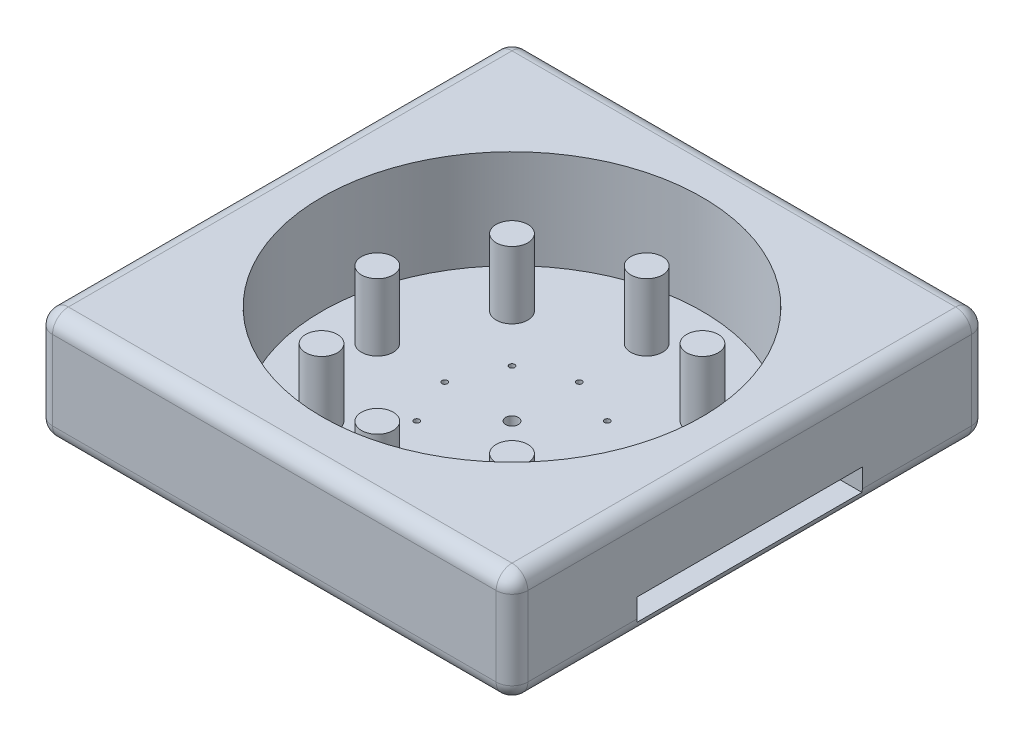
from build123d import *

# Parameters (mm, degrees)
SKETCH_1_W          = 300
SKETCH_1_H          = 300
EXTRUDE_1_DEPTH     = 150
SKETCH_2_R          = 120
CUT_EXTRUDE_1_DEPTH = 62.3
SKETCH_3_R          = 1.75
SKETCH_3_R_2        = 4
CUT_EXTRUDE_2_DEPTH = 10
SKETCH_6_W          = 142.15649329
SKETCH_6_H          = 14
CUT_EXTRUDE_4_DEPTH = 75
SKETCH_11_R         = 10
EXTRUDE_4_DEPTH     = 42.3
FILLET_1_R          = 10
SKETCH_13_W         = 300
SKETCH_13_H         = 300
CUT_EXTRUDE_5_DEPTH = 80
SKETCH_14_R         = 25
EXTRUDE_5_DEPTH     = 5
FILLET_2_R          = 10


with BuildPart() as part:
    # 草图1 → 凸台-拉伸1 (new body)
    with BuildSketch(Plane(origin=(0, 0, 0), x_dir=(1, 0, 0), z_dir=(0, 1, 0))):
        Rectangle(SKETCH_1_W, SKETCH_1_H)
    extrude(amount=EXTRUDE_1_DEPTH)

    # 草图2 → 切除-拉伸1 (cut)
    with BuildSketch(Plane(origin=(0, 150, 0), x_dir=(1, 0, 0), z_dir=(0, 1, 0))):
        with Locations(Location((0, 0, 0), (0, 0, 270))):
            Circle(SKETCH_2_R)
    extrude(amount=-CUT_EXTRUDE_1_DEPTH, mode=Mode.SUBTRACT)

    # 草图3 → 切除-拉伸2 (cut)
    with BuildSketch(Plane(origin=(0, 87.7, 0), x_dir=(1, 0, 0), z_dir=(0, 1, 0))):
        with Locations(Location((42.5, 0, 0), (0, 0, 270))):
            Circle(SKETCH_3_R)
        with Locations(Location((30.0520382, -30.0520382, 0), (0, 0, 270))):
            Circle(SKETCH_3_R)
        with Locations(Location((0, -42.5, 0), (0, 0, 270))):
            Circle(SKETCH_3_R)
        with Locations(Location((-30.0520382, -30.0520382, 0), (0, 0, 270))):
            Circle(SKETCH_3_R)
        with Locations(Location((-42.5, 0, 0), (0, 0, 270))):
            Circle(SKETCH_3_R)
        with Locations(Location((-30.0520382, 30.0520382, 0), (0, 0, 270))):
            Circle(SKETCH_3_R)
        with Locations(Location((0, 42.5, 0), (0, 0, 270))):
            Circle(SKETCH_3_R)
        with Locations(Location((30.0520382, 30.0520382, 0), (0, 0, 270))):
            Circle(SKETCH_3_R)
        with Locations(Location((0, 0, 0), (0, 0, 270))):
            Circle(SKETCH_3_R_2)
    extrude(amount=-CUT_EXTRUDE_2_DEPTH, mode=Mode.SUBTRACT)

    # 草图6 → 切除-拉伸4 (cut)
    with BuildSketch(Plane(origin=(150, 0, 0), x_dir=(0, 0, -1), z_dir=(1, 0, 0))):
        with Locations((0, 95)):
            Rectangle(SKETCH_6_W, SKETCH_6_H)
    extrude(amount=-CUT_EXTRUDE_4_DEPTH, mode=Mode.SUBTRACT)

    # 草图11 → 凸台-拉伸4 (add)
    with BuildSketch(Plane(origin=(0, 87.7, 0), x_dir=(1, 0, 0), z_dir=(0, 1, 0))):
        with Locations(Location((-85, 0, 0), (0, 0, 270))):
            Circle(SKETCH_11_R)
        with Locations(Location((-60.104076401, 60.104076401, 0), (0, 0, 270))):
            Circle(SKETCH_11_R)
        with Locations(Location((0, 85, 0), (0, 0, 270))):
            Circle(SKETCH_11_R)
        with Locations(Location((60.104076401, 60.104076401, 0), (0, 0, 270))):
            Circle(SKETCH_11_R)
        with Locations(Location((60.104076401, -60.104076401, 0), (0, 0, 270))):
            Circle(SKETCH_11_R)
        with Locations(Location((0, -85, 0), (0, 0, 270))):
            Circle(SKETCH_11_R)
        with Locations(Location((-60.104076401, -60.104076401, 0), (0, 0, 270))):
            Circle(SKETCH_11_R)
    extrude(amount=EXTRUDE_4_DEPTH)

    # 圆角1
    fillet_1_edges = [part.edges().sort_by_distance(p)[0] for p in [
        (-150, 150, 0),
        (0, 150, 150),
        (150, 150, 0),
        (0, 0, 150),
        (-150, 0, 0),
        (0, 0, -150),
        (150, 0, 0),
        (150, 75, 150),
        (-150, 75, 150),
        (-150, 75, -150),
        (150, 75, -150),
        (0, 150, -150),
    ]]
    fillet(fillet_1_edges, radius=FILLET_1_R)

    # 草图13 → 切除-拉伸5 (cut)
    with BuildSketch(Plane.XZ):
        Rectangle(SKETCH_13_W, SKETCH_13_H)
    extrude(amount=-CUT_EXTRUDE_5_DEPTH, mode=Mode.SUBTRACT)

    # 草图14 → 凸台-拉伸5 (add)
    with BuildSketch(Plane.XZ.offset(-80)):
        with Locations(Location((0, 104.563725125, 0), (0, 0, 270))):
            Circle(SKETCH_14_R)
        with Locations(Location((-112.815196319, -110.245065947, 0), (0, 0, 270))):
            Circle(SKETCH_14_R)
        with Locations(Location((112.815196319, -110.245065947, 0), (0, 0, 90))):
            Circle(SKETCH_14_R)
    extrude(amount=EXTRUDE_5_DEPTH)

    # 圆角2
    # the kernel refuses this fillet: 10 mm, written as the material it takes off along each edge
    with BuildSketch(Plane(origin=(140, 80, 140), x_dir=(0, 0, 1), z_dir=(-1, 0, 0))) as fillet_2_piece_1:
        with BuildLine():
            CenterArc((10 - FILLET_2_R, FILLET_2_R), FILLET_2_R, 270, 90)
            Line((10, FILLET_2_R), (10, 0))
            Line((10, 0), (10 - FILLET_2_R, 0))
        make_face()
    revolve(axis=Axis((140, 80, 140), (0, 1, 0)), revolution_arc=90, mode=Mode.SUBTRACT)
    with BuildSketch(Plane(origin=(140, 80, -140), x_dir=(1, 0, 0), z_dir=(0, 0, 1))) as fillet_2_piece_2:
        with BuildLine():
            CenterArc((10 - FILLET_2_R, FILLET_2_R), FILLET_2_R, 270, 90)
            Line((10, FILLET_2_R), (10, 0))
            Line((10, 0), (10 - FILLET_2_R, 0))
        make_face()
    revolve(axis=Axis((140, 80, -140), (0, 1, 0)), revolution_arc=90, mode=Mode.SUBTRACT)
    with BuildSketch(Plane(origin=(-140, 80, -140), x_dir=(0, 0, -1), z_dir=(1, 0, 0))) as fillet_2_piece_3:
        with BuildLine():
            CenterArc((10 - FILLET_2_R, FILLET_2_R), FILLET_2_R, 270, 90)
            Line((10, FILLET_2_R), (10, 0))
            Line((10, 0), (10 - FILLET_2_R, 0))
        make_face()
    revolve(axis=Axis((-140, 80, -140), (0, 1, 0)), revolution_arc=90, mode=Mode.SUBTRACT)
    with BuildSketch(Plane(origin=(-140, 80, 140), x_dir=(-1, 0, 0), z_dir=(0, 0, -1))) as fillet_2_piece_4:
        with BuildLine():
            CenterArc((10 - FILLET_2_R, FILLET_2_R), FILLET_2_R, 270, 90)
            Line((10, FILLET_2_R), (10, 0))
            Line((10, 0), (10 - FILLET_2_R, 0))
        make_face()
    revolve(axis=Axis((-140, 80, 140), (0, 1, 0)), revolution_arc=90, mode=Mode.SUBTRACT)
    with BuildSketch(Plane(origin=(-150, 80, -140), x_dir=(1, 0, 0), z_dir=(0, 0, 1)), Plane(origin=(150, 80, 140), x_dir=(-1, 0, 0), z_dir=(0, 0, -1)), Plane(origin=(-140, 80, 150), x_dir=(0, 0, -1), z_dir=(1, 0, 0))) as fillet_2_piece_5:
        with BuildLine():
            CenterArc((FILLET_2_R, FILLET_2_R), FILLET_2_R, 180, 90)
            Line((0, FILLET_2_R), (0, 0))
            Line((0, 0), (FILLET_2_R, 0))
        make_face()
    extrude(amount=280, mode=Mode.SUBTRACT)
    with BuildSketch(Plane(origin=(140, 80, -150), x_dir=(0, 1, 0), z_dir=(-1, 0, 0))) as fillet_2_piece_6:
        with BuildLine():
            CenterArc((FILLET_2_R, -FILLET_2_R), FILLET_2_R, 90, 90)
            Line((0, -FILLET_2_R), (0, 0))
            Line((0, 0), (FILLET_2_R, 0))
        make_face()
    extrude(amount=280, mode=Mode.SUBTRACT)


solid = part.part
